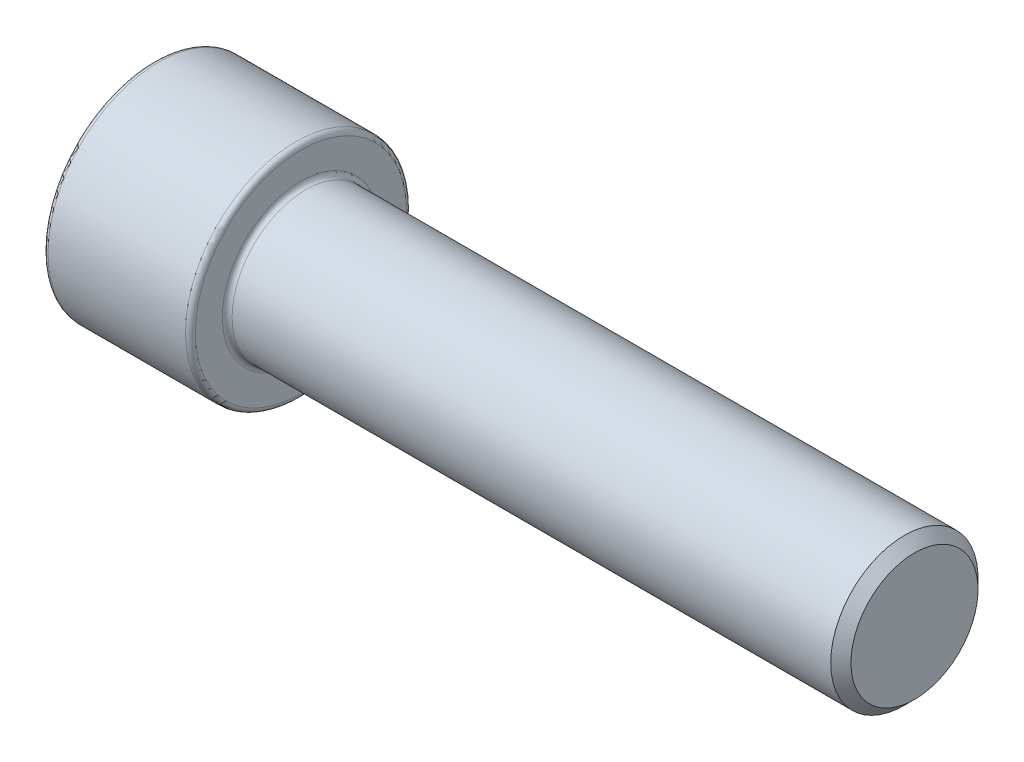
from build123d import *

# Parameters (mm, degrees)
BASEHEADSKE_R   = 18
BASEHEAD_DEPTH  = 24
CUTSOCKET_DEPTH = 12
FILLET_2_R      = 0.8


with BuildPart() as part:
    # BaseHeadSke → BaseHead (new body)
    with BuildSketch(Plane(origin=(0, 0, 0), x_dir=(0, 0, -1), z_dir=(1, 0, 0))):
        Circle(BASEHEADSKE_R)
    extrude(amount=BASEHEAD_DEPTH)

    # BodySke → BaseBody (revolve)
    with BuildSketch(Plane.XY):
        Polygon((0, 0), (124, 0), (124, 10.352), (122.352, 12), (0, 12), align=None)
    revolve(axis=Axis((0, 0, 0), (1, 0, 0)))

    # CutSocketSke → CutSocket (cut)
    with BuildSketch(Plane(origin=(0, 0, 0), x_dir=(0, 0, -1), z_dir=(1, 0, 0))):
        Polygon((0, 10.969655115), (-9.5, 5.484827557), (-9.5, -5.484827557), (0, -10.969655115), (9.5, -5.484827557), (9.5, 5.484827557), align=None)
    extrude(amount=CUTSOCKET_DEPTH, mode=Mode.SUBTRACT)

    # CutHoleSke → CutHole (revolve, cut)
    with BuildSketch(Plane.XY):
        Polygon((0, 9.5), (13.6, 9.5), (19.084827557, 0), (0, 0), align=None)
    revolve(axis=Axis((0, 0, 0), (1, 0, 0)), mode=Mode.SUBTRACT)

    # Fillet 2
    fillet_2_edges = [part.edges().sort_by_distance(p)[0] for p in [
        (24, -12, 0),
        (24, 0, 18),
        (0, 0, 18),
    ]]
    fillet(fillet_2_edges, radius=FILLET_2_R)


solid = part.part
